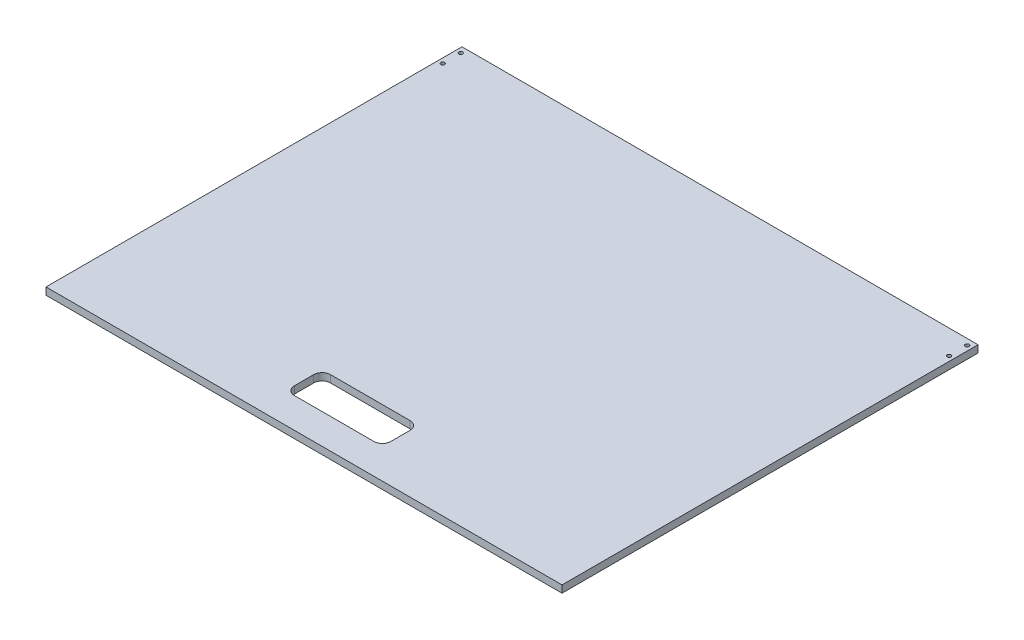
from build123d import *

# Parameters (mm, degrees)
SKETCH1_W           = 428
SKETCH1_H           = 345
BOSS_EXTRUDE1_DEPTH = 6
SKETCH2_R           = 1.6
CUT_EXTRUDE1_DEPTH  = 275.933173699
CUT_EXTRUDE2_DEPTH  = 275.933173699


with BuildPart() as part:
    # Sketch1 → Boss-Extrude1 (new body)
    with BuildSketch(Plane(origin=(0, 0, 0), x_dir=(1, 0, 0), z_dir=(0, 1, 0))):
        Rectangle(SKETCH1_W, SKETCH1_H)
    extrude(amount=BOSS_EXTRUDE1_DEPTH)

    # Sketch2 → Cut-Extrude1 (cut, through all)
    with BuildSketch(Plane.XZ):
        with Locations((210, -152.5)):
            Circle(SKETCH2_R)
        with Locations((210, -167.5)):
            Circle(SKETCH2_R)
    cut_extrude1 = extrude(amount=-CUT_EXTRUDE1_DEPTH, mode=Mode.SUBTRACT)

    # Mirror1: Cut-Extrude1 across plane
    add(cut_extrude1.mirror(Plane(origin=(0, 0, 0), x_dir=(0, 0, 1), z_dir=(1, 0, 0))), mode=Mode.SUBTRACT)

    # Sketch3 → Cut-Extrude2 (cut, through all)
    with BuildSketch(Plane(origin=(0, 6, 0), x_dir=(1, 0, 0), z_dir=(0, 1, 0))):
        with BuildLine():
            Line((-33, -147.5), (33, -147.5))
            ThreePointArc((33, -147.5), (37.949747468, -145.449747468), (40, -140.5))
            Line((40, -140.5), (40, -124.5))
            ThreePointArc((40, -124.5), (37.949747468, -119.550252532), (33, -117.5))
            Line((33, -117.5), (-33, -117.5))
            ThreePointArc((-33, -117.5), (-37.949747468, -119.550252532), (-40, -124.5))
            Line((-40, -124.5), (-40, -140.5))
            ThreePointArc((-40, -140.5), (-37.949747468, -145.449747468), (-33, -147.5))
        make_face()
    extrude(amount=-CUT_EXTRUDE2_DEPTH, mode=Mode.SUBTRACT)


solid = part.part
